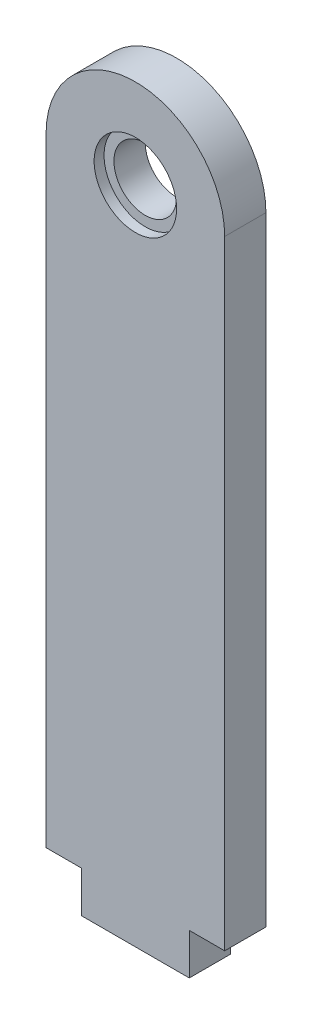
from build123d import *

# Parameters (mm, degrees)
SKETCH1_R           = 4.826
BOSS_EXTRUDE1_DEPTH = 6.35
CUT_EXTRUDE1_START  = -1.524
SKETCH2_R           = 6.35
SKETCH2_R_2         = 4.826
CUT_EXTRUDE1_DEPTH  = 1.524


with BuildPart() as part:
    # Sketch1 → Boss-Extrude1 (new body)
    with BuildSketch(Plane.XY):
        with BuildLine():
            Line((0, 95.25), (0, 0))
            Line((0, 0), (5.449505508, 0))
            Line((5.449505508, 0), (5.449505508, -6.35))
            Line((5.449505508, -6.35), (22.050494492, -6.35))
            Line((22.050494492, -6.35), (22.050494492, 0))
            Line((22.050494492, 0), (27.5, 0))
            Line((27.5, 0), (27.5, 95.25))
            ThreePointArc((27.5, 95.25), (13.75, 109), (0, 95.25))
        make_face()
        with Locations((13.75, 95.25)):
            Circle(SKETCH1_R, mode=Mode.SUBTRACT)
    extrude(amount=BOSS_EXTRUDE1_DEPTH)

    # Sketch2 → Cut-Extrude1 (cut)
    with BuildSketch(Plane.XY.offset(6.35).offset(CUT_EXTRUDE1_START)):
        with Locations((13.75, 95.25)):
            Circle(SKETCH2_R)
        with Locations((13.75, 95.25)):
            Circle(SKETCH2_R_2, mode=Mode.SUBTRACT)
    extrude(amount=CUT_EXTRUDE1_DEPTH, mode=Mode.SUBTRACT)


solid = part.part
